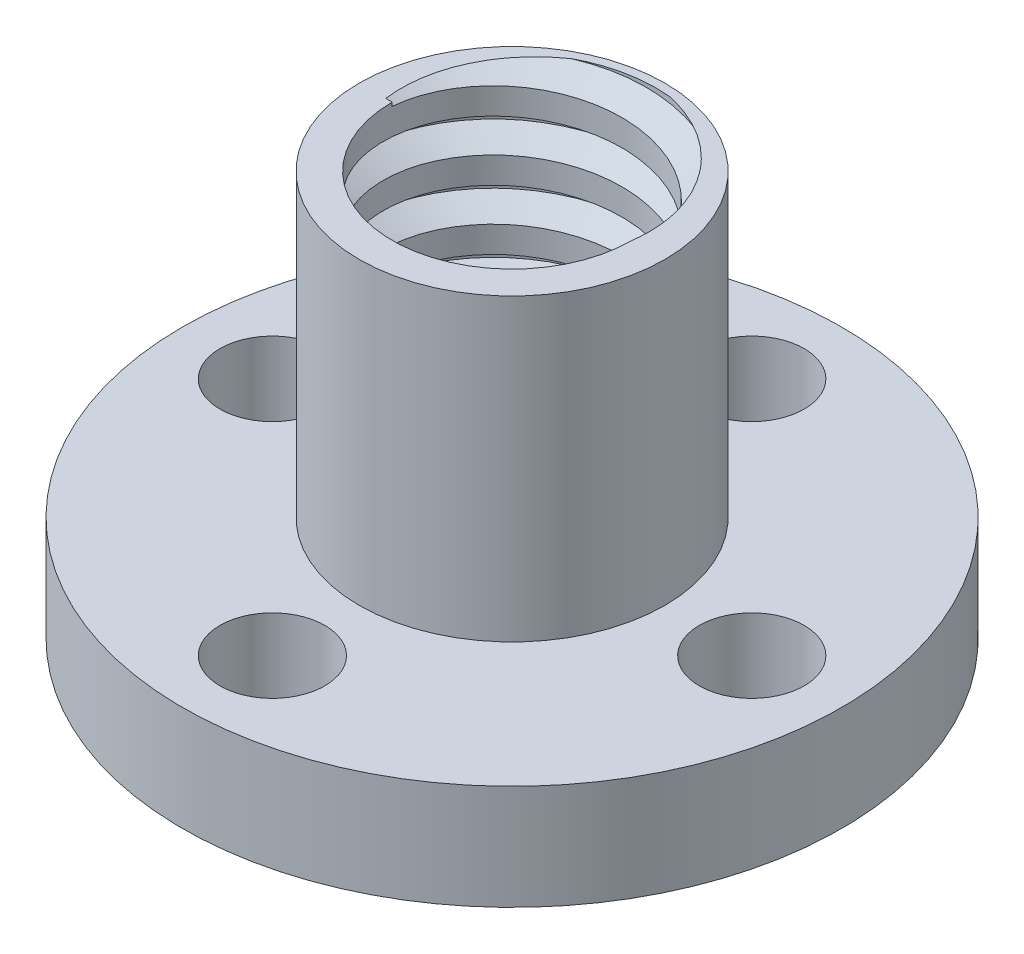
from build123d import *

# Parameters (mm, degrees)
ESQUISSE2_R             = 1.75
ENL_V_MAT_EXTRU_1_DEPTH = 19.493242009
FILETAGE1_PITCH         = 2


with BuildPart() as part:
    # Esquisse1 → Révolution1 (revolve)
    with BuildSketch(Plane.XY):
        Polygon((-4, 0), (-5.1, 0), (-5.1, 1.5), (-11, 1.5), (-11, 5), (-5.1, 5), (-5.1, 15), (-4, 15), align=None)
    revolve(axis=Axis((0, 0, 0), (0, -1, 0)))

    # Esquisse2 → Enlèv. mat.-Extru.1 (cut, through all)
    with BuildSketch(Plane(origin=(0, 5, 0), x_dir=(1, 0, 0), z_dir=(0, 1, 0))):
        with Locations(Location((0, 8, 0), (0, 0, 180))):
            Circle(ESQUISSE2_R)
        with Locations(Location((8, 0, 0), (0, 0, 180))):
            Circle(ESQUISSE2_R)
        with Locations(Location((0, -8, 0), (0, 0, 180))):
            Circle(ESQUISSE2_R)
        with Locations(Location((-8, 0, 0), (0, 0, 180))):
            Circle(ESQUISSE2_R)
    extrude(amount=-ENL_V_MAT_EXTRU_1_DEPTH, mode=Mode.SUBTRACT)

    # Filetage1: the profile of Profil de filetage1 profile screwed along a right-hand helix of 8 turns, 10 arcs to a turn; built about Z, then put on its axis
    filetage1_z = Axis((0, 0, 0), (0, 0, 1))
    filetage1_corners = [(3.9997, 0, -0.000173205), (4.811898813, 0, 0.468749998), (4.811898813, 0, 0.656249998), (3.9997, 0, 1.125173201)]
    with BuildLine(mode=Mode.PRIVATE) as filetage1_profile:
        Line(filetage1_corners[0], filetage1_corners[1])
        Line(filetage1_corners[1], filetage1_corners[2])
        Line(filetage1_corners[2], filetage1_corners[3])
        Line(filetage1_corners[3], filetage1_corners[0])
    filetage1_cap = Face(filetage1_profile.wire())
    filetage1_turn_angles = [0, 18, 36, 54, 72, 90, 108, 126, 144, 162, 180, 198, 216, 234, 252, 270, 288, 306, 324, 342, 360]
    filetage1_turn_weights = [1, 0.9510565162951535, 1, 0.9510565162951535, 1, 0.9510565162951535, 1, 0.9510565162951535, 1, 0.9510565162951535, 1, 0.9510565162951535, 1, 0.9510565162951535, 1, 0.9510565162951535, 1, 0.9510565162951535, 1, 0.9510565162951535, 1]
    filetage1_turn_rails = [Edge.make_bspline([Vector(p[0], p[1], 0).rotate(filetage1_z, filetage1_turn_angles[k]) / filetage1_turn_weights[k] + Vector(0, 0, p[2] + FILETAGE1_PITCH * filetage1_turn_angles[k] / 360) for k in range(21)], [0, 0, 0, 1, 1, 2, 2, 3, 3, 4, 4, 5, 5, 6, 6, 7, 7, 8, 8, 9, 9, 10, 10, 10], 2, filetage1_turn_weights) for p in filetage1_corners]
    filetage1_turn_sides = [Face.make_surface_from_curves(filetage1_turn_rails[p[0]], filetage1_turn_rails[p[1]]) for p in [(0, 1), (1, 2), (2, 3), (3, 0)]]
    filetage1 = Plane(origin=(0, 16, 0), x_dir=(-1, 0, 0), z_dir=(0, -1, 0)) * Solid(Shell([*[p.moved(Location((0, 0, FILETAGE1_PITCH * i))) for i in range(8) for p in filetage1_turn_sides], filetage1_cap, filetage1_cap.rotate(filetage1_z, 2880).moved(Location((0, 0, FILETAGE1_PITCH * 2880 / 360)))]))
    add(filetage1, mode=Mode.SUBTRACT)


solid = part.part
